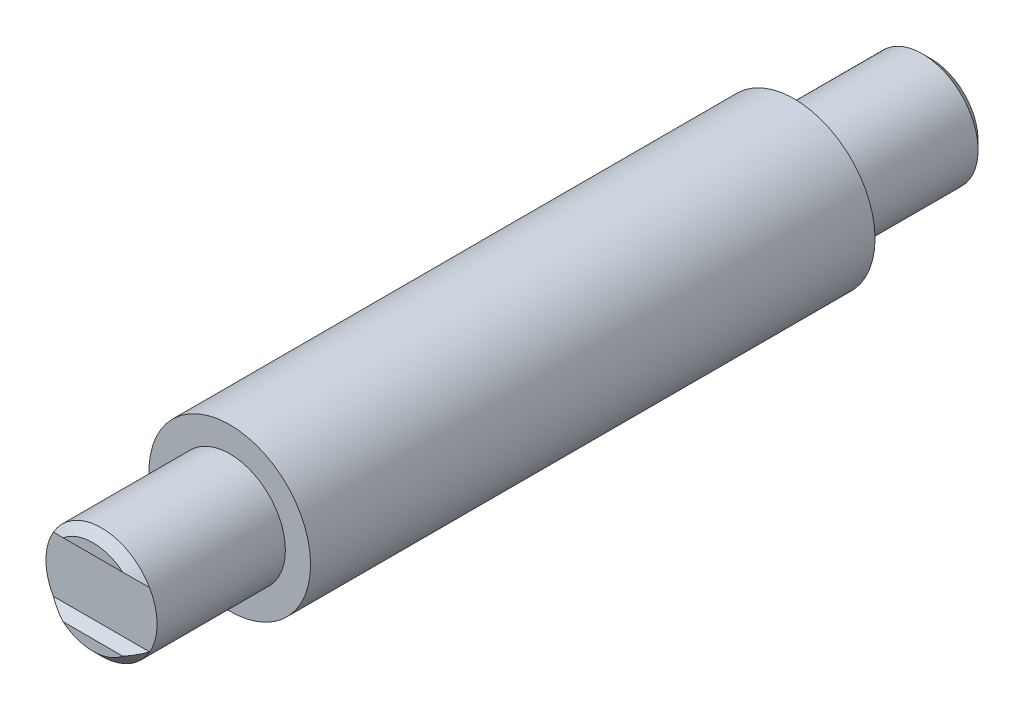
from build123d import *

# Parameters (mm, degrees)
CROQUIS1_R              = 9.45
SALIENTE_EXTRUIR1_DEPTH = 66
CROQUIS7_R              = 6.5
SALIENTE_EXTRUIR5_DEPTH = 16
CHAFL_N5_SIZE           = 1
SALIENTE_EXTRUIR6_START = 16
CROQUIS12_R             = 6.5
SALIENTE_EXTRUIR6_DEPTH = 16
CORTAR_EXTRUIR12_DEPTH  = 1
CHAFL_N7_SIZE           = 1.25
CHAFL_N8_SIZE           = 1.25
CHAFL_N9_SIZE           = 1
CHAFL_N10_SIZE          = 1


with BuildPart() as part:
    # Croquis1 → Saliente-Extruir1 (new body)
    with BuildSketch(Plane.XY):
        Circle(CROQUIS1_R)
    extrude(amount=SALIENTE_EXTRUIR1_DEPTH)

    # Croquis7 → Saliente-Extruir5 (add)
    with BuildSketch(Plane(origin=(0, 0, 0), x_dir=(-1, 0, 0), z_dir=(0, 0, -1))):
        Circle(CROQUIS7_R)
    extrude(amount=SALIENTE_EXTRUIR5_DEPTH)

    # Chaflán5
    chafl_n5_edges = [part.edges().sort_by_distance(p)[0] for p in [
        (6.5, 0, -16),
    ]]
    chamfer(chafl_n5_edges, length=CHAFL_N5_SIZE)

    # Croquis12 → Saliente-Extruir6 (add)
    with BuildSketch(Plane.XY.offset(66).offset(SALIENTE_EXTRUIR6_START)):
        with Locations(Location((0, 0, 0), (0, 0, 180))):
            Circle(CROQUIS12_R)
    extrude(amount=-SALIENTE_EXTRUIR6_DEPTH)

    # Croquis13 → Cortar-Extruir12 (cut)
    with BuildSketch(Plane.XY.offset(82)):
        with BuildLine():
            Line((5.766281297, -3), (-5.766281297, -3))
            ThreePointArc((-5.766281297, -3), (-6.5, 0), (-5.766281297, 3))
            Line((-5.766281297, 3), (5.766281297, 3))
            ThreePointArc((5.766281297, 3), (6.5, 0), (5.766281297, -3))
        make_face()
    extrude(amount=-CORTAR_EXTRUIR12_DEPTH, mode=Mode.SUBTRACT)

    # Chaflán7
    # the kernel refuses this chamfer: 1.25 mm, written as the material it takes off along each edge
    with BuildSketch(Plane(origin=(-8.980885032, 3, 82), x_dir=(0, -0.02749587661058643, -0.9996219169112968), z_dir=(1, 0, 0))) as chafl_n7_piece_1_section:
        Polygon((CHAFL_N7_SIZE * 0.999621916911, CHAFL_N7_SIZE * 0.0274958766106), (-CHAFL_N7_SIZE * 0.0274958766106, CHAFL_N7_SIZE * 0.999621916911), (0, 0), align=None)
    chafl_n7_piece_1 = extrude(amount=17.961770065, mode=Mode.PRIVATE)
    chafl_n7_piece_1 = split(chafl_n7_piece_1, bisect_by=Plane(origin=(0, 3.432148015, 81), z_dir=(0, 0, 1)), keep=Keep.TOP, mode=Mode.PRIVATE)
    add(chafl_n7_piece_1, mode=Mode.SUBTRACT)

    # Chaflán8
    # the kernel refuses this chamfer: 1.25 mm, written as the material it takes off along each edge
    with BuildSketch(Plane(origin=(8.980885032, -3, 82), x_dir=(0, -0.9996219169112969, 0.027495876610582178), z_dir=(-1, 0, 0))) as chafl_n8_piece_1_section:
        Polygon((CHAFL_N8_SIZE * 0.999621916911, -CHAFL_N8_SIZE * 0.0274958766106), (-CHAFL_N8_SIZE * 0.0274958766106, -CHAFL_N8_SIZE * 0.999621916911), (0, 0), align=None)
    chafl_n8_piece_1 = extrude(amount=17.961770065, mode=Mode.PRIVATE)
    chafl_n8_piece_1 = split(chafl_n8_piece_1, bisect_by=Plane(origin=(0, -3.432148015, 81), z_dir=(0, 0, 1)), keep=Keep.TOP, mode=Mode.PRIVATE)
    add(chafl_n8_piece_1, mode=Mode.SUBTRACT)

    # Chaflán9
    chafl_n9_edges = [part.edges().sort_by_distance(p)[0] for p in [
        (0, 6.5, 82),
    ]]
    chamfer(chafl_n9_edges, length=CHAFL_N9_SIZE)

    # Chaflán10
    chafl_n10_edges = [part.edges().sort_by_distance(p)[0] for p in [
        (0, -6.5, 82),
    ]]
    chamfer(chafl_n10_edges, length=CHAFL_N10_SIZE)


solid = part.part
